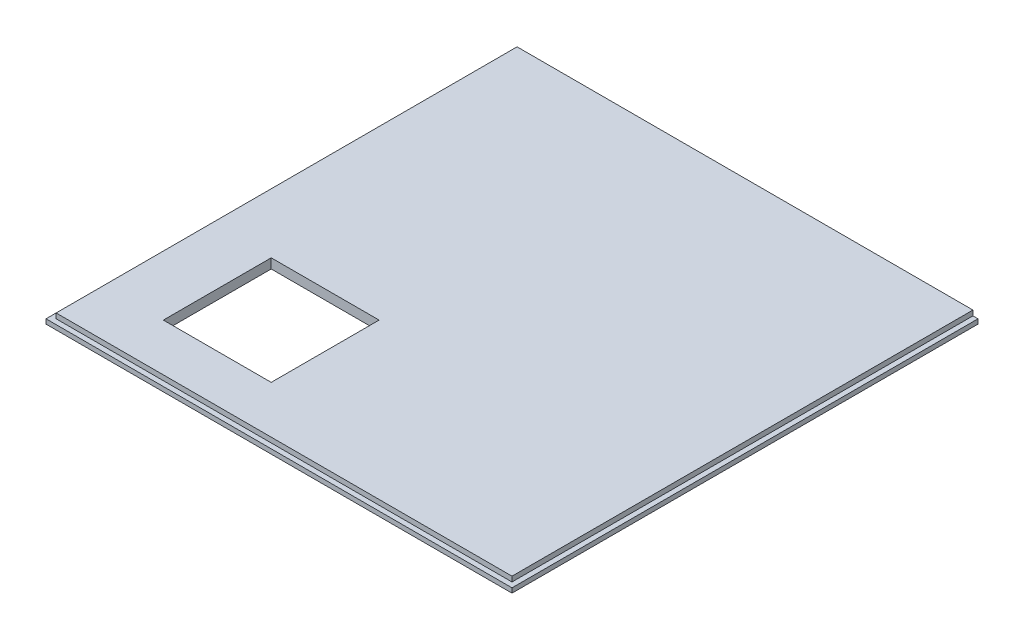
from build123d import *

# Parameters (mm, degrees)
SKETCH1_W           = 877.8875
SKETCH1_H           = 877.8875
BOSS_EXTRUDE1_DEPTH = 18.25625
CUT_EXTRUDE1_DEPTH  = 9.525
SKETCH4_W           = 203.2
SKETCH4_H           = 203.2
CUT_EXTRUDE2_DEPTH  = 19.05


with BuildPart() as part:
    # Sketch1 → Boss-Extrude1 (new body)
    with BuildSketch(Plane(origin=(0, 0, 0), x_dir=(1, 0, 0), z_dir=(0, 1, 0))):
        Rectangle(SKETCH1_W, SKETCH1_H)
    extrude(amount=BOSS_EXTRUDE1_DEPTH)

    # Sketch3 → Cut-Extrude1 (cut)
    with BuildSketch(Plane(origin=(0, 18.25625, 0), x_dir=(1, 0, 0), z_dir=(0, 1, 0))):
        Polygon((429.41875, 438.94375), (438.94375, 438.94375), (438.94375, -438.94375), (-438.94375, -438.94375), (-438.94375, 438.94375), (-429.41875, 438.94375), (-429.41875, -429.41875), (429.41875, -429.41875), align=None)
    extrude(amount=-CUT_EXTRUDE1_DEPTH, mode=Mode.SUBTRACT)

    # Sketch4 → Cut-Extrude2 (cut)
    with BuildSketch(Plane(origin=(0, 18.25625, 0), x_dir=(1, 0, 0), z_dir=(0, 1, 0))):
        with Locations((-215.151244121, -238.441776777)):
            Rectangle(SKETCH4_W, SKETCH4_H)
    extrude(amount=-CUT_EXTRUDE2_DEPTH, mode=Mode.SUBTRACT)


solid = part.part
